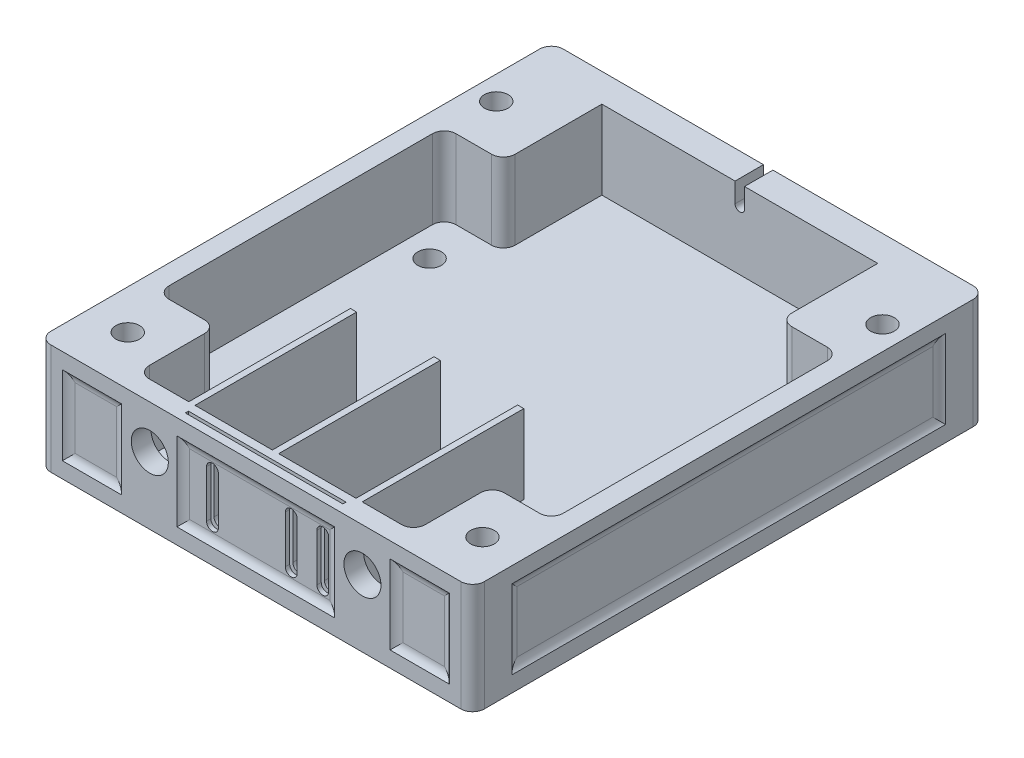
from build123d import *

# Parameters (mm, degrees)
SKETCH1_W           = 139.7
SKETCH1_H           = 165.1
BOSS_EXTRUDE1_DEPTH = 10.16
SKETCH2_R           = 3.81
CUT_EXTRUDE1_DEPTH  = 10.16
SKETCH3_W           = 139.7
SKETCH3_H           = 165.1
BOSS_EXTRUDE2_DEPTH = 25.4
SKETCH5_R           = 5.969
CUT_EXTRUDE3_DEPTH  = 6.35
FILLET1_R           = 3.81
SKETCH6_R           = 3.81
CUT_EXTRUDE4_DEPTH  = 25.4
SKETCH7_R           = 3.175
CUT_EXTRUDE5_DEPTH  = 10.16
SKETCH12_W          = 82.55
SKETCH12_H          = 19.05
CUT_EXTRUDE9_DEPTH  = 1.27
SKETCH13_W          = 50.8
SKETCH13_H          = 25.4
SKETCH13_W_2        = 19.05
CUT_EXTRUDE10_DEPTH = 1.27
FILLET3_R           = 3.81
FILLET4_R           = 3.81
SKETCH17_W          = 139.7
SKETCH17_H          = 25.4
CUT_EXTRUDE11_DEPTH = 1.27
SKETCH18_W          = 139.7
SKETCH18_H          = 25.4
CUT_EXTRUDE12_DEPTH = 1.27
FILLET5_R           = 3.81
SKETCH19_R          = 3.81
CUT_EXTRUDE13_DEPTH = 25.4
CUT_EXTRUDE14_DEPTH = 9.144
CHAMFER1_SIZE       = 2.54
SKETCH21_W          = 2
SKETCH21_H          = 52.07
SKETCH21_W_2        = 2.032
BOSS_EXTRUDE3_DEPTH = 25.4
SKETCH22_W          = 50.8
SKETCH22_H          = 1.016
CUT_EXTRUDE15_DEPTH = 29.21


with BuildPart() as part:
    # Sketch1 → Boss-Extrude1 (new body)
    with BuildSketch(Plane(origin=(0, 0, 0), x_dir=(1, 0, 0), z_dir=(0, 1, 0))):
        with Locations((69.85, 82.55)):
            Rectangle(SKETCH1_W, SKETCH1_H)
    extrude(amount=BOSS_EXTRUDE1_DEPTH)

    # Sketch2 → Cut-Extrude1 (cut)
    with BuildSketch(Plane(origin=(0, 10.16, 0), x_dir=(1, 0, 0), z_dir=(0, 1, 0))):
        with Locations(Location((15.35, 110.49, 0), (0, 0, 270))):
            Circle(SKETCH2_R)
        with Locations(Location((124.35, 110.49, 0), (0, 0, 270))):
            Circle(SKETCH2_R)
    extrude(amount=-CUT_EXTRUDE1_DEPTH, mode=Mode.SUBTRACT)

    # Sketch3 → Boss-Extrude2 (add)
    with BuildSketch(Plane(origin=(0, 10.16, 0), x_dir=(1, 0, 0), z_dir=(0, 1, 0))):
        with Locations((69.85, 82.55)):
            Rectangle(SKETCH3_W, SKETCH3_H)
        Polygon((6.35, 124.206), (25.4, 124.206), (25.4, 155.956), (69.85, 155.956), (114.3, 155.956), (114.3, 124.46), (133.35, 124.46), (133.35, 31.75), (114.3, 31.75), (114.3, 6.35), (25.4, 6.35), (25.4, 31.75), (6.35, 31.75), align=None, mode=Mode.SUBTRACT)
    extrude(amount=BOSS_EXTRUDE2_DEPTH)

    # Sketch5 → Cut-Extrude3 (cut)
    with BuildSketch(Plane.XY):
        with Locations((35.690000001, 21.66)):
            Circle(SKETCH5_R)
        with Locations((104.21, 21.66)):
            Circle(SKETCH5_R)
        with BuildLine():
            Line((78.105, 25.4), (78.105, 10.16))
            ThreePointArc((78.105, 10.16), (80.01, 8.255), (81.915, 10.16))
            Line((81.915, 10.16), (81.915, 25.4))
            ThreePointArc((81.915, 25.4), (80.01, 27.305), (78.105, 25.4))
        make_face()
        with BuildLine():
            Line((88.265, 25.4), (88.265, 10.16))
            ThreePointArc((88.265, 10.16), (90.17, 8.255), (92.075, 10.16))
            Line((92.075, 10.16), (92.075, 25.4))
            ThreePointArc((92.075, 25.4), (90.17, 27.305), (88.265, 25.4))
        make_face()
        with BuildLine():
            Line((56.515, 25.4), (56.515, 10.16))
            ThreePointArc((56.515, 10.16), (54.61, 8.255), (52.705, 10.16))
            Line((52.705, 10.16), (52.705, 25.4))
            ThreePointArc((52.705, 25.4), (54.61, 27.305), (56.515, 25.4))
        make_face()
    extrude(amount=-CUT_EXTRUDE3_DEPTH, mode=Mode.SUBTRACT)

    # Fillet1
    fillet1_edges = [part.edges().sort_by_distance(p)[0] for p in [
        (25.4, 22.86, -6.35),
        (114.3, 22.86, -6.35),
        (114.3, 22.86, -31.75),
        (133.35, 22.86, -31.75),
        (133.35, 22.86, -124.46),
        (114.3, 22.86, -124.46),
        (25.4, 22.86, -124.206),
        (6.35, 22.86, -124.206),
        (6.35, 22.86, -31.75),
        (25.4, 22.86, -31.75),
        (0, 17.78, -165.1),
        (139.7, 17.78, -165.1),
        (139.7, 17.78, 0),
        (0, 17.78, 0),
    ]]
    fillet(fillet1_edges, radius=FILLET1_R)

    # Sketch6 → Cut-Extrude4 (cut)
    with BuildSketch(Plane(origin=(0, 35.56, 0), x_dir=(1, 0, 0), z_dir=(0, 1, 0))):
        with Locations(Location((12.7, 15.875, 0), (0, 0, 270))):
            Circle(SKETCH6_R)
        with Locations(Location((127, 15.875, 0), (0, 0, 90))):
            Circle(SKETCH6_R)
    extrude(amount=-CUT_EXTRUDE4_DEPTH, mode=Mode.SUBTRACT)

    # Sketch7 → Cut-Extrude5 (cut)
    with BuildSketch(Plane(origin=(0, 10.16, 0), x_dir=(1, 0, 0), z_dir=(0, 1, 0))):
        with Locations(Location((22.85, 44.45, 0), (0, 0, 270))):
            Circle(SKETCH7_R)
        with Locations(Location((116.85, 44.45, 0), (0, 0, 270))):
            Circle(SKETCH7_R)
    extrude(amount=-CUT_EXTRUDE5_DEPTH, mode=Mode.SUBTRACT)

    # Sketch12 → Cut-Extrude9 (cut)
    with BuildSketch(Plane(origin=(0, 0, -165.1), x_dir=(-1, 0, 0), z_dir=(0, 0, -1))):
        with Locations((-69.85, 17.78)):
            Rectangle(SKETCH12_W, SKETCH12_H)
    extrude(amount=-CUT_EXTRUDE9_DEPTH, mode=Mode.SUBTRACT)

    # Sketch13 → Cut-Extrude10 (cut)
    with BuildSketch(Plane.XY):
        with Locations((69.85, 17.78)):
            Rectangle(SKETCH13_W, SKETCH13_H)
        with Locations((122.655611371, 17.78)):
            Rectangle(SKETCH13_W_2, SKETCH13_H)
        with Locations((17.044388629, 17.78)):
            Rectangle(SKETCH13_W_2, SKETCH13_H)
    extrude(amount=-CUT_EXTRUDE10_DEPTH, mode=Mode.SUBTRACT)

    # Fillet3
    # the kernel refuses this fillet: 3.81 mm, written as the material it adds along each edge
    with BuildSketch(Plane(origin=(37.350484171, 5.08, -1.27), x_dir=(0, 0, 1), z_dir=(1, 0, 0)), Plane(origin=(102.349515829, 30.48, -1.27), x_dir=(0, 0, 1), z_dir=(-1, 0, 0))) as fillet3_piece_1:
        with BuildLine():
            CenterArc((3.81, -2.839806331), FILLET3_R, 131.810314896, 48.189685104)
            Line((0, -2.839806331), (0, 0))
            Line((0, 0), (1.27, 0))
        make_face()
    extrude(amount=64.999031657)
    with BuildSketch(Plane(origin=(44.45, 30.48, -1.27), x_dir=(0, 0, 1), z_dir=(0, -1, 0)), Plane(origin=(95.25, 5.08, -1.27), x_dir=(0, 0, 1), z_dir=(0, 1, 0)), Plane(origin=(7.519388629, 30.48, -1.27), x_dir=(0, 0, 1), z_dir=(0, -1, 0)), Plane(origin=(26.569388629, 5.08, -1.27), x_dir=(0, 0, 1), z_dir=(0, 1, 0))) as fillet3_piece_2:
        with BuildLine():
            CenterArc((3.81, -2.839806331), FILLET3_R, 131.810314896, 48.189685104)
            Line((0, -2.839806331), (0, 0))
            Line((0, 0), (1.27, 0))
        make_face()
    extrude(amount=25.4)
    with BuildSketch(Plane(origin=(132.180611371, 30.48, -1.27), x_dir=(0, 0, 1), z_dir=(0, -1, 0)), Plane(origin=(113.130611371, 5.08, -1.27), x_dir=(0, 0, 1), z_dir=(0, 1, 0))) as fillet3_piece_3:
        with BuildLine():
            CenterArc((3.81, 2.839806331), FILLET3_R, 180, 48.189685104)
            Line((0, 2.839806331), (0, 0))
            Line((0, 0), (1.27, 0))
        make_face()
    extrude(amount=25.4)
    with BuildSketch(Plane(origin=(106.031095542, 30.48, -1.27), x_dir=(0, 0, 1), z_dir=(1, 0, 0)), Plane(origin=(132.180611371, 5.08, -1.27), x_dir=(0, 0, 1), z_dir=(-1, 0, 0))) as fillet3_piece_4:
        with BuildLine():
            CenterArc((3.81, 2.839806331), FILLET3_R, 180, 48.189685104)
            Line((0, 2.839806331), (0, 0))
            Line((0, 0), (1.27, 0))
        make_face()
    extrude(amount=26.149515829)
    with BuildSketch(Plane(origin=(7.519388629, 5.08, -1.27), x_dir=(0, 0, 1), z_dir=(1, 0, 0)), Plane(origin=(33.668904458, 30.48, -1.27), x_dir=(0, 0, 1), z_dir=(-1, 0, 0))) as fillet3_piece_5:
        with BuildLine():
            CenterArc((3.81, -2.839806331), FILLET3_R, 131.810314896, 48.189685104)
            Line((0, -2.839806331), (0, 0))
            Line((0, 0), (1.27, 0))
        make_face()
    extrude(amount=26.149515829)

    # Fillet4
    # the kernel refuses this fillet: 3.81 mm, written as the material it adds along each edge
    with BuildSketch(Plane(origin=(28.575, 34.404515829, -163.83), x_dir=(0, 0, -1), z_dir=(0, -1, 0)), Plane(origin=(111.125, 1.155484171, -163.83), x_dir=(0, 0, -1), z_dir=(0, 1, 0))) as fillet4_piece_1:
        with BuildLine():
            CenterArc((3.81, 2.839806331), FILLET4_R, 180, 48.189685104)
            Line((0, 2.839806331), (-0.0762, 2.839806331))
            Line((-0.0762, 2.839806331), (-0.0762, 0))
            Line((-0.0762, 0), (0, -0.0762))
            ThreePointArc((0, -0.0762), (0.635, -0.0762), (1.2192, -0.056796127))
            Line((1.2192, -0.056796127), (1.27, 0))
        make_face()
    extrude(amount=33.249031657)
    with BuildSketch(Plane(origin=(21.475484171, 8.255, -163.83), x_dir=(0, 0, -1), z_dir=(1, 0, 0))) as fillet4_piece_2:
        with BuildLine():
            CenterArc((3.81, 2.839806331), FILLET4_R, 180, 48.189685104)
            Line((0, 2.839806331), (-0.0762, 2.839806331))
            Line((-0.0762, 2.839806331), (-0.0762, 0))
            Line((-0.0762, 0), (0, -0.0762))
            ThreePointArc((0, -0.0762), (0.635, -0.0762), (1.2192, -0.056796127))
            Line((1.2192, -0.056796127), (1.27, 0))
        make_face()
    extrude(amount=96.749031657)

    # Sketch17 → Cut-Extrude11 (cut)
    with BuildSketch(Plane.ZY):
        with Locations((-82.55, 17.78)):
            Rectangle(SKETCH17_W, SKETCH17_H)
    extrude(amount=-CUT_EXTRUDE11_DEPTH, mode=Mode.SUBTRACT)

    # Sketch18 → Cut-Extrude12 (cut)
    with BuildSketch(Plane(origin=(139.7, 0, 0), x_dir=(0, 0, -1), z_dir=(1, 0, 0))):
        with Locations((82.55, 17.78)):
            Rectangle(SKETCH18_W, SKETCH18_H)
    extrude(amount=-CUT_EXTRUDE12_DEPTH, mode=Mode.SUBTRACT)

    # Fillet5
    # the kernel refuses this fillet: 3.81 mm, written as the material it adds along each edge
    with BuildSketch(Plane(origin=(1.27, 30.48, -12.7), x_dir=(-1, 0, 0), z_dir=(0, -1, 0)), Plane(origin=(1.27, 5.08, -152.4), x_dir=(-1, 0, 0), z_dir=(0, 1, 0)), Plane(origin=(138.43, 30.48, -152.4), x_dir=(1, 0, 0), z_dir=(0, -1, 0)), Plane(origin=(138.43, 5.08, -12.7), x_dir=(1, 0, 0), z_dir=(0, 1, 0))) as fillet5_piece_1:
        with BuildLine():
            CenterArc((3.81, 2.839806331), FILLET5_R, 180, 48.189685104)
            Line((0, 2.839806331), (0, 0))
            Line((0, 0), (1.27, 0))
        make_face()
    extrude(amount=25.4)
    with BuildSketch(Plane(origin=(1.27, 5.08, -5.600484171), x_dir=(-1, 0, 0), z_dir=(0, 0, -1)), Plane(origin=(1.27, 30.48, -159.499515829), x_dir=(-1, 0, 0), z_dir=(0, 0, 1)), Plane(origin=(138.43, 5.08, -159.499515829), x_dir=(1, 0, 0), z_dir=(0, 0, 1)), Plane(origin=(138.43, 30.48, -5.600484171), x_dir=(1, 0, 0), z_dir=(0, 0, -1))) as fillet5_piece_2:
        with BuildLine():
            CenterArc((3.81, 2.839806331), FILLET5_R, 180, 48.189685104)
            Line((0, 2.839806331), (0, 0))
            Line((0, 0), (1.27, 0))
        make_face()
    extrude(amount=153.899031657)

    # Sketch19 → Cut-Extrude13 (cut)
    with BuildSketch(Plane(origin=(0, 35.56, 0), x_dir=(1, 0, 0), z_dir=(0, 1, 0))):
        with Locations(Location((7.62, 139.7, 0), (0, 0, 270))):
            Circle(SKETCH19_R)
        with Locations(Location((132.08, 139.7, 0), (0, 0, 270))):
            Circle(SKETCH19_R)
    extrude(amount=-CUT_EXTRUDE13_DEPTH, mode=Mode.SUBTRACT)

    # Sketch20 → Cut-Extrude14 (cut)
    with BuildSketch(Plane(origin=(0, 0, -165.1), x_dir=(-1, 0, 0), z_dir=(0, 0, -1))):
        with BuildLine():
            Line((-71.374, 29.21), (-71.374, 35.56))
            Line((-71.374, 35.56), (-68.326, 35.56))
            Line((-68.326, 35.56), (-68.326, 29.21))
            ThreePointArc((-68.326, 29.21), (-69.85, 27.686), (-71.374, 29.21))
        make_face()
    extrude(amount=-CUT_EXTRUDE14_DEPTH, mode=Mode.SUBTRACT)

    # Chamfer1
    # the kernel refuses this chamfer: 2.54 mm, written as the material it takes off along each edge
    with BuildSketch(Plane(origin=(98.607074789, 10.16, -6.35), x_dir=(0, 0.027495876610586684, -0.9996219169112968), z_dir=(-1, 0, 0))) as chamfer1_piece_1_section:
        Polygon((CHAMFER1_SIZE * 0.999621916911, CHAMFER1_SIZE * 0.0274958766106), (-CHAMFER1_SIZE * 0.0274958766106, CHAMFER1_SIZE * 0.999621916911), (0, 0), align=None)
    chamfer1_piece_1 = extrude(amount=16.874149579, mode=Mode.PRIVATE)
    chamfer1_piece_1 = chamfer1_piece_1 & Plane(origin=(90.17, 10.16, -7.28897011), x_dir=(-1, 0, 0), z_dir=(0, 0, 1)) * Cylinder(1.905, 44, mode=Mode.PRIVATE)
    add(chamfer1_piece_1, mode=Mode.SUBTRACT)
    with BuildSketch(Plane(origin=(98.607074789, 10.16, -6.35), x_dir=(0, 0.027495876610586684, -0.9996219169112968), z_dir=(-1, 0, 0))) as chamfer1_piece_2_section:
        Polygon((CHAMFER1_SIZE * 0.999621916911, CHAMFER1_SIZE * 0.0274958766106), (-CHAMFER1_SIZE * 0.0274958766106, CHAMFER1_SIZE * 0.999621916911), (0, 0), align=None)
    chamfer1_piece_2 = extrude(amount=16.874149579, mode=Mode.PRIVATE)
    chamfer1_piece_2 = chamfer1_piece_2 & Plane(origin=(80.01, 10.16, -7.475433422), x_dir=(-1, 0, 0), z_dir=(0, 0, 1)) * Cylinder(1.905, 44, mode=Mode.PRIVATE)
    add(chamfer1_piece_2, mode=Mode.SUBTRACT)
    with BuildSketch(Plane(origin=(88.447074789, 10.16, -6.35), x_dir=(0, 0.027495876610586684, -0.9996219169112968), z_dir=(-1, 0, 0))) as chamfer1_piece_3_section:
        Polygon((CHAMFER1_SIZE * 0.999621916911, CHAMFER1_SIZE * 0.0274958766106), (-CHAMFER1_SIZE * 0.0274958766106, CHAMFER1_SIZE * 0.999621916911), (0, 0), align=None)
    chamfer1_piece_3 = extrude(amount=16.874149579, mode=Mode.PRIVATE)
    chamfer1_piece_3 = chamfer1_piece_3 & Plane(origin=(90.17, 10.16, -7.475433422), x_dir=(-1, 0, 0), z_dir=(0, 0, 1)) * Cylinder(1.905, 44, mode=Mode.PRIVATE)
    add(chamfer1_piece_3, mode=Mode.SUBTRACT)
    with BuildSketch(Plane(origin=(88.447074789, 10.16, -6.35), x_dir=(0, 0.027495876610586684, -0.9996219169112968), z_dir=(-1, 0, 0))) as chamfer1_piece_4_section:
        Polygon((CHAMFER1_SIZE * 0.999621916911, CHAMFER1_SIZE * 0.0274958766106), (-CHAMFER1_SIZE * 0.0274958766106, CHAMFER1_SIZE * 0.999621916911), (0, 0), align=None)
    chamfer1_piece_4 = extrude(amount=16.874149579, mode=Mode.PRIVATE)
    chamfer1_piece_4 = chamfer1_piece_4 & Plane(origin=(80.01, 10.16, -7.28897011), x_dir=(-1, 0, 0), z_dir=(0, 0, 1)) * Cylinder(1.905, 44, mode=Mode.PRIVATE)
    add(chamfer1_piece_4, mode=Mode.SUBTRACT)
    with BuildSketch(Plane(origin=(63.047074789, 10.16, -6.35), x_dir=(0, 0.027495876610586684, -0.9996219169112968), z_dir=(-1, 0, 0))) as chamfer1_piece_5_section:
        Polygon((CHAMFER1_SIZE * 0.999621916911, CHAMFER1_SIZE * 0.0274958766106), (-CHAMFER1_SIZE * 0.0274958766106, CHAMFER1_SIZE * 0.999621916911), (0, 0), align=None)
    chamfer1_piece_5 = extrude(amount=16.874149579, mode=Mode.PRIVATE)
    chamfer1_piece_5 = chamfer1_piece_5 & Plane(origin=(54.61, 10.16, -7.28897011), x_dir=(1, 0, 0), z_dir=(0, 0, 1)) * Cylinder(1.905, 44, mode=Mode.PRIVATE)
    add(chamfer1_piece_5, mode=Mode.SUBTRACT)

    # Sketch21 → Boss-Extrude3 (add)
    with BuildSketch(Plane(origin=(0, 10.16, 0), x_dir=(1, 0, 0), z_dir=(0, 1, 0))):
        with Locations((42.91, 32.385)):
            Rectangle(SKETCH21_W, SKETCH21_H)
        with Locations((96.79, 32.385)):
            Rectangle(SKETCH21_W, SKETCH21_H)
        with Locations((69.85, 32.385)):
            Rectangle(SKETCH21_W_2, SKETCH21_H)
    extrude(amount=BOSS_EXTRUDE3_DEPTH)

    # Sketch22 → Cut-Extrude15 (cut)
    with BuildSketch(Plane(origin=(0, 35.56, 0), x_dir=(1, 0, 0), z_dir=(0, 1, 0))):
        with Locations((69.85, 3.175)):
            Rectangle(SKETCH22_W, SKETCH22_H)
    extrude(amount=-CUT_EXTRUDE15_DEPTH, mode=Mode.SUBTRACT)


solid = part.part
